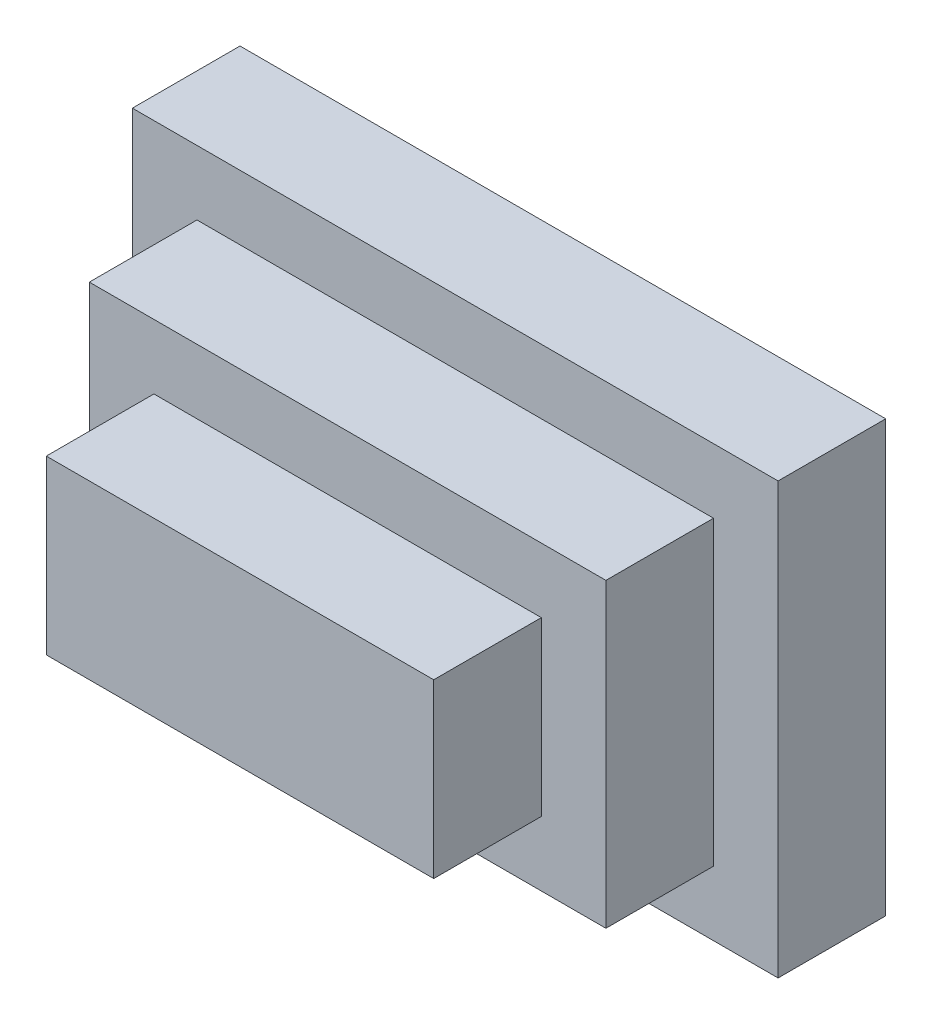
from build123d import *

# Parameters (mm, degrees)
SKETCH2_W           = 300
SKETCH2_H           = 200
BOSS_EXTRUDE1_DEPTH = 50
SKETCH3_W           = 240
SKETCH3_H           = 140
BOSS_EXTRUDE2_DEPTH = 50
SKETCH4_W           = 180
SKETCH4_H           = 80
BOSS_EXTRUDE3_DEPTH = 50
SKETCH3_2_W         = 240
SKETCH3_2_H         = 140
CUT_EXTRUDE1_DEPTH  = 50
SKETCH4_2_W         = 180
SKETCH4_2_H         = 80
CUT_EXTRUDE2_DEPTH  = 50


with BuildPart() as part:
    # Sketch2 → Boss-Extrude1 (new body)
    with BuildSketch(Plane.XY):
        Rectangle(SKETCH2_W, SKETCH2_H)
    extrude(amount=BOSS_EXTRUDE1_DEPTH)

    # Sketch3 → Boss-Extrude2 (add)
    with BuildSketch(Plane.XY.offset(50)):
        Rectangle(SKETCH3_W, SKETCH3_H)
    extrude(amount=BOSS_EXTRUDE2_DEPTH)

    # Sketch4 → Boss-Extrude3 (add)
    with BuildSketch(Plane.XY.offset(100)):
        Rectangle(SKETCH4_W, SKETCH4_H)
    extrude(amount=BOSS_EXTRUDE3_DEPTH)

    # Sketch3<2> → Cut-Extrude1 (cut)
    with BuildSketch(Plane.XY.offset(50)):
        Rectangle(SKETCH3_2_W, SKETCH3_2_H)
    extrude(amount=-CUT_EXTRUDE1_DEPTH, mode=Mode.SUBTRACT)


with BuildPart() as cut_extrude1_piece_1:
    # of the separate pieces the step leaves, piece 1, a body of its own (cut_extrude1_pieces)
    add(part.part.solids().sort_by_distance((-120, 70, 100))[0])

    # Sketch4<2> → Cut-Extrude2 (cut)
    with BuildSketch(Plane.XY.offset(100)):
        Rectangle(SKETCH4_2_W, SKETCH4_2_H)
    extrude(amount=-CUT_EXTRUDE2_DEPTH, mode=Mode.SUBTRACT)


with BuildPart() as cut_extrude1_piece_2:
    # of the separate pieces the step leaves, piece 2, a body of its own (cut_extrude1_pieces)
    add(part.part.solids().sort_by_distance((-150, 100, 0))[0])


with BuildPart() as cut_extrude2_piece_1:
    # of the separate pieces the step leaves, piece 1, a body of its own (cut_extrude2_pieces)
    add(cut_extrude1_piece_1.part.solids().sort_by_distance((-120, 70, 50))[0])


with BuildPart() as cut_extrude2_piece_2:
    # of the separate pieces the step leaves, piece 2, a body of its own (cut_extrude2_pieces)
    add(cut_extrude1_piece_1.part.solids().sort_by_distance((-90, -40, 150))[0])


solid = Compound([cut_extrude1_piece_2.part, cut_extrude2_piece_1.part, cut_extrude2_piece_2.part])
